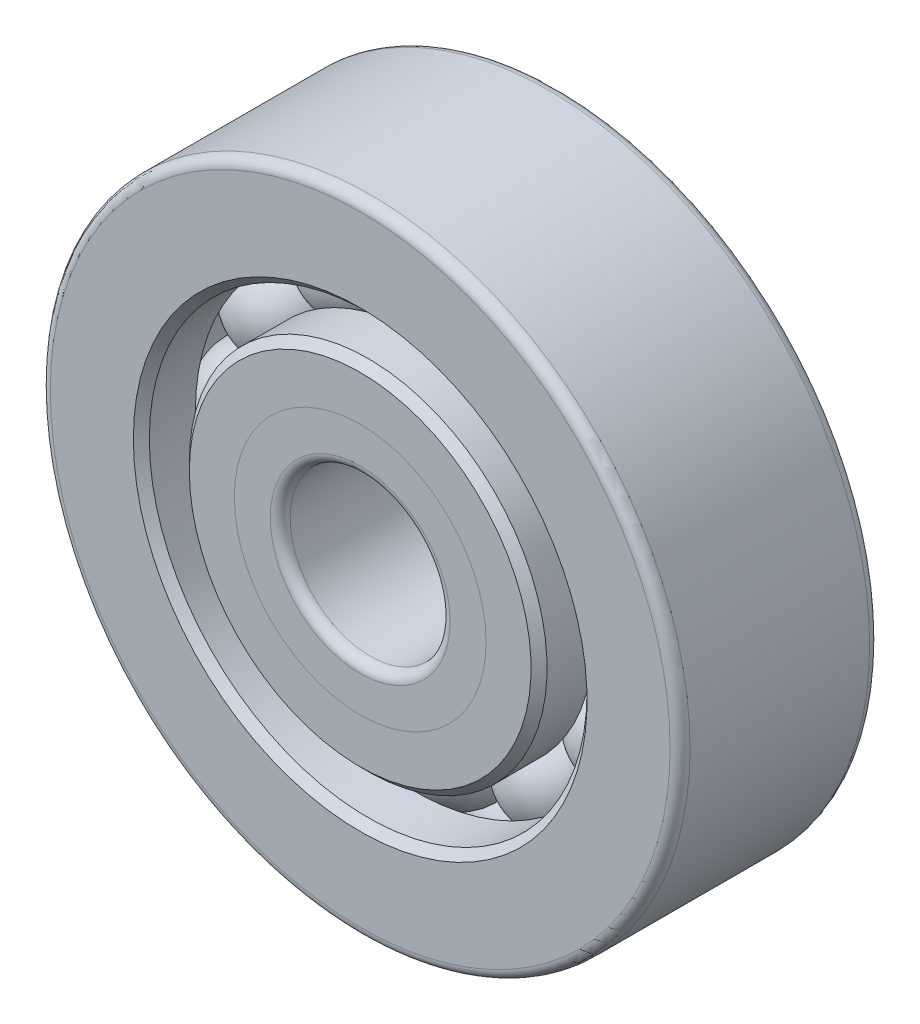
from build123d import *

# Parameters (mm, degrees)
SKETCH3_W              = 7.9248
SKETCH3_H              = 3.926586
SKETCH3_H_2            = 4.010406
SKETCH4_R              = 1.98501
CIRPATTERN1_COUNT      = 12
FILLET1_R              = 0.39624
FILLET2_R              = 0.39624
CHAMFER1_SIZE          = 0.316992
CHAMFER2_SIZE          = 0.316992
SPLIT1_SURFACE_1_BACK  = 37.785
SPLIT1_SURFACE_1_DEPTH = 75.57
SPLIT1_SURFACE_2_BACK  = 37.785
SPLIT1_SURFACE_2_DEPTH = 75.57


with BuildPart() as part:
    # Sketch3 → Revolve2 (revolve)
    with BuildSketch(Plane(origin=(0, 0, 0), x_dir=(0, 0, -1), z_dir=(1, 0, 0))):
        with Locations((0, 5.138293)):
            Rectangle(SKETCH3_W, SKETCH3_H)
        with Locations((0, 10.694797)):
            Rectangle(SKETCH3_W, SKETCH3_H_2)
    revolve(axis=Axis((0, 0, 3.9624), (0, 0, -1)))

    # Sketch4 → Cut-Revolve1 (revolve, cut)
    with BuildSketch(Plane(origin=(0, 0, 0), x_dir=(0, 0, -1), z_dir=(1, 0, 0))):
        with Locations((0, 7.89559)):
            Circle(SKETCH4_R)
    revolve(axis=Axis((0, 0, 3.9624), (0, 0, -1)), mode=Mode.SUBTRACT)

    # Fillet1
    fillet1_edges = [part.edges().sort_by_distance(p)[0] for p in [
        (0, -12.7, 3.9624),
        (0, -12.7, -3.9624),
    ]]
    fillet(fillet1_edges, radius=FILLET1_R)

    # Fillet2
    fillet2_edges = [part.edges().sort_by_distance(p)[0] for p in [
        (0, -3.175, -3.9624),
        (0, -3.175, 3.9624),
    ]]
    fillet(fillet2_edges, radius=FILLET2_R)

    # Chamfer1
    chamfer1_edges = [part.edges().sort_by_distance(p)[0] for p in [
        (0, -8.689594, -3.9624),
        (0, -8.689594, 3.9624),
    ]]
    chamfer(chamfer1_edges, length=CHAMFER1_SIZE)

    # Chamfer2
    chamfer2_edges = [part.edges().sort_by_distance(p)[0] for p in [
        (0, -7.101586, 3.9624),
        (0, -7.101586, -3.9624),
    ]]
    chamfer(chamfer2_edges, length=CHAMFER2_SIZE)


with BuildPart() as body_2:
    # Sketch5 → Revolve3 (revolve)
    with BuildSketch(Plane(origin=(0, 0, 0), x_dir=(0, 0, -1), z_dir=(1, 0, 0))):
        with BuildLine():
            Line((-1.98501, 7.89559), (1.98501, 7.89559))
            ThreePointArc((1.98501, 7.89559), (0, 9.8806), (-1.98501, 7.89559))
        make_face()
    revolve(axis=Axis((0, 7.89559, 1.98501), (0, 0, -1)))


with BuildPart() as cirpattern1_1:
    # CirPattern1: pattern copy
    add(body_2.part.rotate(Axis((0, 0, 3.9624), (0, 0, -1)), 1 * 360 / CIRPATTERN1_COUNT))


with BuildPart() as cirpattern1_2:
    # CirPattern1: pattern copy
    add(body_2.part.rotate(Axis((0, 0, 3.9624), (0, 0, -1)), 2 * 360 / CIRPATTERN1_COUNT))


with BuildPart() as cirpattern1_3:
    # CirPattern1: pattern copy
    add(body_2.part.rotate(Axis((0, 0, 3.9624), (0, 0, -1)), 3 * 360 / CIRPATTERN1_COUNT))


with BuildPart() as cirpattern1_4:
    # CirPattern1: pattern copy
    add(body_2.part.rotate(Axis((0, 0, 3.9624), (0, 0, -1)), 4 * 360 / CIRPATTERN1_COUNT))


with BuildPart() as cirpattern1_5:
    # CirPattern1: pattern copy
    add(body_2.part.rotate(Axis((0, 0, 3.9624), (0, 0, -1)), 5 * 360 / CIRPATTERN1_COUNT))


with BuildPart() as cirpattern1_6:
    # CirPattern1: pattern copy
    add(body_2.part.rotate(Axis((0, 0, 3.9624), (0, 0, -1)), 6 * 360 / CIRPATTERN1_COUNT))


with BuildPart() as cirpattern1_7:
    # CirPattern1: pattern copy
    add(body_2.part.rotate(Axis((0, 0, 3.9624), (0, 0, -1)), 7 * 360 / CIRPATTERN1_COUNT))


with BuildPart() as cirpattern1_8:
    # CirPattern1: pattern copy
    add(body_2.part.rotate(Axis((0, 0, 3.9624), (0, 0, -1)), 8 * 360 / CIRPATTERN1_COUNT))


with BuildPart() as cirpattern1_9:
    # CirPattern1: pattern copy
    add(body_2.part.rotate(Axis((0, 0, 3.9624), (0, 0, -1)), 9 * 360 / CIRPATTERN1_COUNT))


with BuildPart() as cirpattern1_10:
    # CirPattern1: pattern copy
    add(body_2.part.rotate(Axis((0, 0, 3.9624), (0, 0, -1)), 10 * 360 / CIRPATTERN1_COUNT))


with BuildPart() as cirpattern1_11:
    # CirPattern1: pattern copy
    add(body_2.part.rotate(Axis((0, 0, 3.9624), (0, 0, -1)), 11 * 360 / CIRPATTERN1_COUNT))


with BuildPart() as body_14:
    # Split1: the piece behind the surface
    add(part.part)
    # Split1 surface: a surface, the sketch's curves swept straight by 75.57 mm
    with BuildLine(Plane.XY.offset(-SPLIT1_SURFACE_1_BACK), mode=Mode.PRIVATE) as split1_surface_1_path:
        CenterArc((0, 0), 4.99872, 0, 360)
    split1_surface_1 = Shell.extrude(split1_surface_1_path.wire(), (0 * SPLIT1_SURFACE_1_DEPTH, 0 * SPLIT1_SURFACE_1_DEPTH, 1 * SPLIT1_SURFACE_1_DEPTH))
    split(bisect_by=split1_surface_1, keep=Keep.BOTTOM)


with BuildPart() as part_1:
    add(part.part)

    # Split1: split by a surface, the side it looks to stays
    # Split1 surface: a surface, the sketch's curves swept straight by 75.57 mm
    with BuildLine(Plane.XY.offset(-SPLIT1_SURFACE_2_BACK), mode=Mode.PRIVATE) as split1_surface_2_path:
        CenterArc((0, 0), 4.99872, 0, 360)
    split1_surface_2 = Shell.extrude(split1_surface_2_path.wire(), (0 * SPLIT1_SURFACE_2_DEPTH, 0 * SPLIT1_SURFACE_2_DEPTH, 1 * SPLIT1_SURFACE_2_DEPTH))
    split(bisect_by=split1_surface_2, keep=Keep.TOP)


solid = Compound([body_2.part, cirpattern1_1.part, cirpattern1_2.part, cirpattern1_3.part, cirpattern1_4.part, cirpattern1_5.part, cirpattern1_6.part, cirpattern1_7.part, cirpattern1_8.part, cirpattern1_9.part, cirpattern1_10.part, cirpattern1_11.part, body_14.part, part_1.part])
